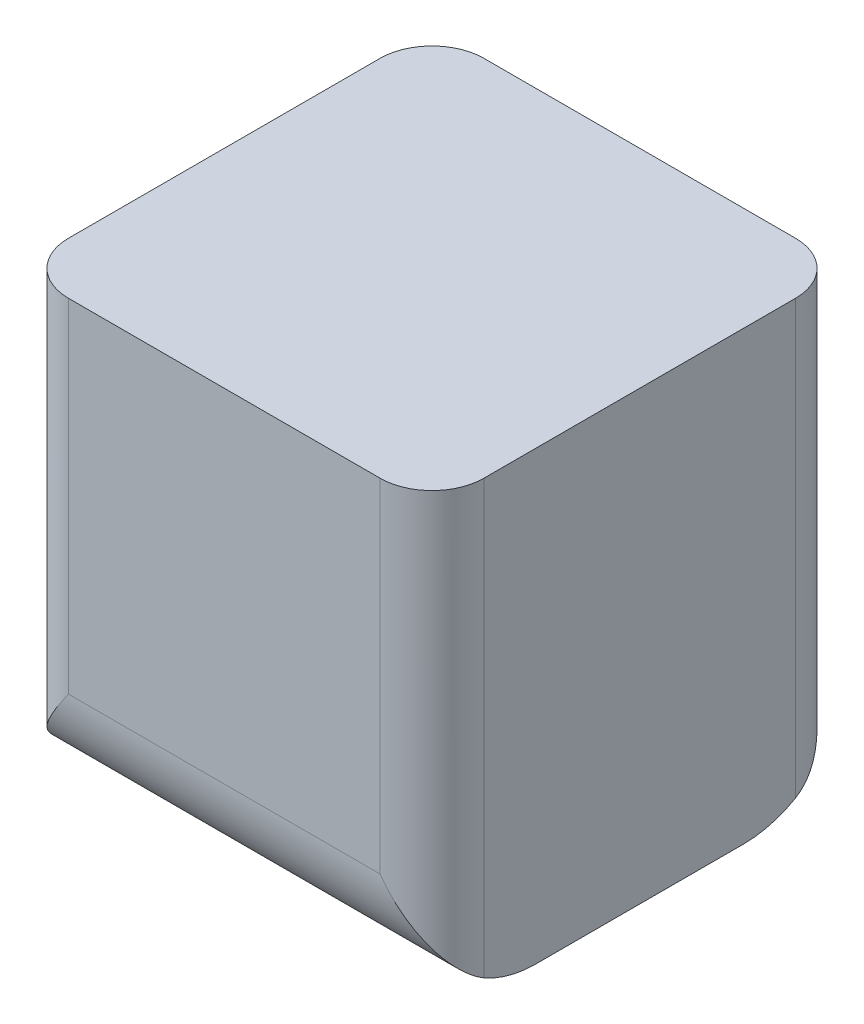
from build123d import *

# Parameters (mm, degrees)
SKETCH1_W           = 4
SKETCH1_H           = 4.3
BOSS_EXTRUDE1_DEPTH = 2
FILLET1_R           = 0.5
FILLET2_R           = 1


with BuildPart() as part:
    # Sketch1 → Boss-Extrude1 (new, symmetric)
    with BuildSketch(Plane.XY):
        with Locations((0, 4.094)):
            Rectangle(SKETCH1_W, SKETCH1_H)
    extrude(amount=BOSS_EXTRUDE1_DEPTH, both=True)

    # Fillet1
    # the kernel refuses this fillet: 0.5 mm, written as the material it takes off along each edge
    with BuildSketch(Plane(origin=(2, 7.494, 2), x_dir=(-1, 0, 0), z_dir=(0, -1, 0)), Plane(origin=(-2, 0.694, 2), x_dir=(1, 0, 0), z_dir=(0, 1, 0)), Plane(origin=(2, 7.494, -2), x_dir=(0, 0, 1), z_dir=(0, -1, 0))) as fillet1_piece_1:
        with BuildLine():
            CenterArc((FILLET1_R, FILLET1_R), FILLET1_R, 180, 90)
            Line((0, FILLET1_R), (-FILLET1_R * 0.02, FILLET1_R))
            Line((-FILLET1_R * 0.02, FILLET1_R), (-FILLET1_R * 0.02, -FILLET1_R * 0.02))
            Line((-FILLET1_R * 0.02, -FILLET1_R * 0.02), (FILLET1_R, -FILLET1_R * 0.02))
            Line((FILLET1_R, -FILLET1_R * 0.02), (FILLET1_R, 0))
        make_face()
    extrude(amount=6.8, mode=Mode.SUBTRACT)
    with BuildSketch(Plane(origin=(-2, 0.694, -2), x_dir=(1, 0, 0), z_dir=(0, 1, 0))) as fillet1_piece_2:
        with BuildLine():
            CenterArc((FILLET1_R, -FILLET1_R), FILLET1_R, 90, 90)
            Line((0, -FILLET1_R), (-FILLET1_R * 0.02, -FILLET1_R))
            Line((-FILLET1_R * 0.02, -FILLET1_R), (-FILLET1_R * 0.02, FILLET1_R * 0.02))
            Line((-FILLET1_R * 0.02, FILLET1_R * 0.02), (FILLET1_R, FILLET1_R * 0.02))
            Line((FILLET1_R, FILLET1_R * 0.02), (FILLET1_R, 0))
        make_face()
    extrude(amount=6.8, mode=Mode.SUBTRACT)

    # Fillet2
    # the kernel refuses this fillet: 1 mm, written as the material it takes off along each edge
    with BuildSketch(Plane(origin=(4, 1.944, 2), x_dir=(0, 1, 0), z_dir=(-1, 0, 0))) as fillet2_piece_1:
        with BuildLine():
            CenterArc((FILLET2_R, FILLET2_R), FILLET2_R, 180, 90)
            Line((0, FILLET2_R), (0, 0))
            Line((0, 0), (FILLET2_R, 0))
        make_face()
    extrude(amount=8, mode=Mode.SUBTRACT)
    with BuildSketch(Plane(origin=(4, 1.944, -2), x_dir=(0, 1, 0), z_dir=(-1, 0, 0))) as fillet2_piece_2:
        with BuildLine():
            CenterArc((FILLET2_R, -FILLET2_R), FILLET2_R, 90, 90)
            Line((0, -FILLET2_R), (0, 0))
            Line((0, 0), (FILLET2_R, 0))
        make_face()
    extrude(amount=8, mode=Mode.SUBTRACT)


solid = part.part
